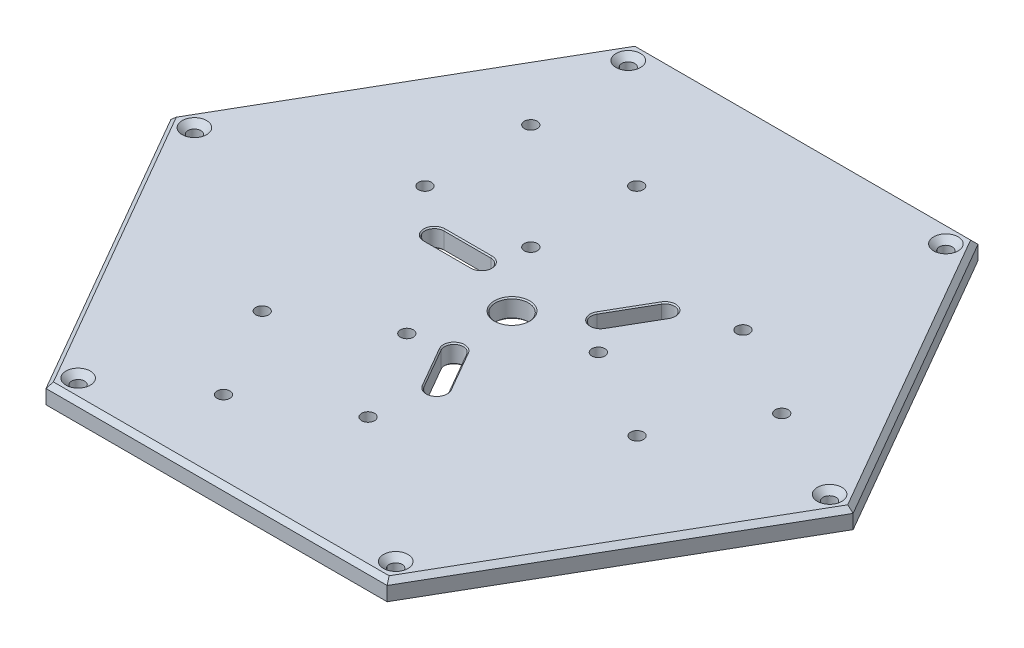
from build123d import *

# Parameters (mm, degrees)
BOSS_EXTRUDE1_DEPTH                             = 8
SKETCH5_R                                       = 7
CUT_EXTRUDE1_DEPTH                              = 192.983723268
CSK_FOR_M5_FLAT_HEAD_MACHINE_SCREW1_D           = 5.5
CSK_FOR_M5_FLAT_HEAD_MACHINE_SCREW1_CSINK_D     = 10.4
CSK_FOR_M5_FLAT_HEAD_MACHINE_SCREW1_CSINK_ANGLE = 90
CUT_EXTRUDE3_DEPTH                              = 192.983723268
CSK_FOR_M5_FLAT_HEAD_MACHINE_SCREW2_D           = 5.5
CSK_FOR_M5_FLAT_HEAD_MACHINE_SCREW2_DEPTH       = 10
CSK_FOR_M5_FLAT_HEAD_MACHINE_SCREW2_CSINK_D     = 10.4
CSK_FOR_M5_FLAT_HEAD_MACHINE_SCREW2_CSINK_ANGLE = 90
CSK_FOR_M5_FLAT_HEAD_MACHINE_SCREW2_TIP         = 1.652366702
CHAMFER1_SIZE                                   = 0.5
CHAMFER3_SIZE                                   = 0.5
CHAMFER4_SIZE                                   = 2


with BuildPart() as part:
    # Sketch1 → Boss-Extrude1 (new body)
    with BuildSketch(Plane(origin=(0, 0, 0), x_dir=(1, 0, 0), z_dir=(0, 1, 0))):
        Polygon((72.5, 125.573683549), (-72.5, 125.573683549), (-145, 0), (-72.5, -125.573683549), (72.5, -125.573683549), (145, 0), align=None)
    extrude(amount=BOSS_EXTRUDE1_DEPTH)

    # Sketch5 → Cut-Extrude1 (cut, through all)
    with BuildSketch(Plane(origin=(0, 8, 0), x_dir=(1, 0, 0), z_dir=(0, 1, 0))):
        Circle(SKETCH5_R)
    extrude(amount=-CUT_EXTRUDE1_DEPTH, mode=Mode.SUBTRACT)

    # CSK for M5 Flat Head Machine Screw1 (through all)
    with Locations(Plane(origin=(0, 0, 0), x_dir=(-1, 0, 0), z_dir=(0, -1, 0))):
        with Locations((64.5, 27.5), (19.5, 27.5), (19.5, 72.5), (64.5, 72.5), (-33.565698604, 3.137495374), (-72.536841774, -19.362504626), (-95.036841774, 19.608638544), (-56.065698604, 42.108638544), (14.065698604, -30.637495374), (-8.434301396, -69.608638544), (30.536841774, -92.108638544), (53.036841774, -53.137495374)):
            CounterSinkHole(CSK_FOR_M5_FLAT_HEAD_MACHINE_SCREW1_D / 2, CSK_FOR_M5_FLAT_HEAD_MACHINE_SCREW1_CSINK_D / 2, counter_sink_angle=CSK_FOR_M5_FLAT_HEAD_MACHINE_SCREW1_CSINK_ANGLE)

    # Sketch9 → Cut-Extrude3 (cut, through all)
    with BuildSketch(Plane.XZ):
        with BuildLine():
            Line((28.745190528, -34.788130468), (18.745190528, -17.467622393))
            ThreePointArc((18.745190528, -17.467622393), (20.209292144, -12.003520778), (25.673393759, -13.467622393))
            Line((25.673393759, -13.467622393), (35.673393759, -30.788130468))
            ThreePointArc((35.673393759, -30.788130468), (34.209292144, -36.252232084), (28.745190528, -34.788130468))
        make_face()
        with BuildLine():
            Line((-44.5, -7.5), (-24.5, -7.5))
            ThreePointArc((-24.5, -7.5), (-20.5, -11.5), (-24.5, -15.5))
            Line((-24.5, -15.5), (-44.5, -15.5))
            ThreePointArc((-44.5, -15.5), (-48.5, -11.5), (-44.5, -7.5))
        make_face()
        with BuildLine():
            Line((15.754809472, 42.288130468), (5.754809472, 24.967622393))
            ThreePointArc((5.754809472, 24.967622393), (0.290707856, 23.503520778), (-1.173393759, 28.967622393))
            Line((-1.173393759, 28.967622393), (8.826606241, 46.288130468))
            ThreePointArc((8.826606241, 46.288130468), (14.290707856, 47.752232084), (15.754809472, 42.288130468))
        make_face()
    extrude(amount=-CUT_EXTRUDE3_DEPTH, mode=Mode.SUBTRACT)

    # CSK for M5 Flat Head Machine Screw2
    with Locations(Plane(origin=(0, 8, 0), x_dir=(1, 0, 0), z_dir=(0, 1, 0))):
        with Locations((-135, 0), (-67.5, -116.913429511), (67.5, -116.913429511), (135, 0), (67.5, 116.913429511), (-67.5, 116.913429511)):
            CounterSinkHole(CSK_FOR_M5_FLAT_HEAD_MACHINE_SCREW2_D / 2, CSK_FOR_M5_FLAT_HEAD_MACHINE_SCREW2_CSINK_D / 2, depth=CSK_FOR_M5_FLAT_HEAD_MACHINE_SCREW2_DEPTH, counter_sink_angle=CSK_FOR_M5_FLAT_HEAD_MACHINE_SCREW2_CSINK_ANGLE)
            with Locations((0, 0, -(CSK_FOR_M5_FLAT_HEAD_MACHINE_SCREW2_DEPTH + CSK_FOR_M5_FLAT_HEAD_MACHINE_SCREW2_TIP / 2))):  # 118° drill point
                Cone(0, CSK_FOR_M5_FLAT_HEAD_MACHINE_SCREW2_D / 2, CSK_FOR_M5_FLAT_HEAD_MACHINE_SCREW2_TIP, mode=Mode.SUBTRACT)

    # Chamfer1
    chamfer1_edges = [part.edges().sort_by_distance(p)[0] for p in [
        (-34.5, 0, -15.5),
        (-20.5, 0, -11.5),
        (-48.5, 0, -11.5),
        (-34.5, 0, -7.5),
        (23.745190528, 0, -26.127876431),
        (34.209292144, 0, -36.252232084),
        (20.209292144, 0, -12.003520778),
        (30.673393759, 0, -22.127876431),
        (3.826606241, 0, 37.627876431),
        (0.290707856, 0, 23.503520778),
        (14.290707856, 0, 47.752232084),
        (10.754809472, 0, 33.627876431),
        (-34.5, 8, -15.5),
        (-20.5, 8, -11.5),
        (-48.5, 8, -11.5),
        (-34.5, 8, -7.5),
        (23.745190528, 8, -26.127876431),
        (34.209292144, 8, -36.252232084),
        (20.209292144, 8, -12.003520778),
        (30.673393759, 8, -22.127876431),
        (3.826606241, 8, 37.627876431),
        (0.290707856, 8, 23.503520778),
        (14.290707856, 8, 47.752232084),
        (10.754809472, 8, 33.627876431),
    ]]
    chamfer(chamfer1_edges, length=CHAMFER1_SIZE)

    # Chamfer3
    chamfer3_edges = [part.edges().sort_by_distance(p)[0] for p in [
        (-7, 8, 0),
        (-7, 0, 0),
    ]]
    chamfer(chamfer3_edges, length=CHAMFER3_SIZE)

    # Chamfer4
    chamfer4_edges = [part.edges().sort_by_distance(p)[0] for p in [
        (0, 8, 125.573683549),
        (108.75, 8, 62.786841774),
        (108.75, 8, -62.786841774),
        (0, 8, -125.573683549),
        (-108.75, 8, -62.786841774),
        (-108.75, 8, 62.786841774),
    ]]
    chamfer(chamfer4_edges, length=CHAMFER4_SIZE)


solid = part.part
